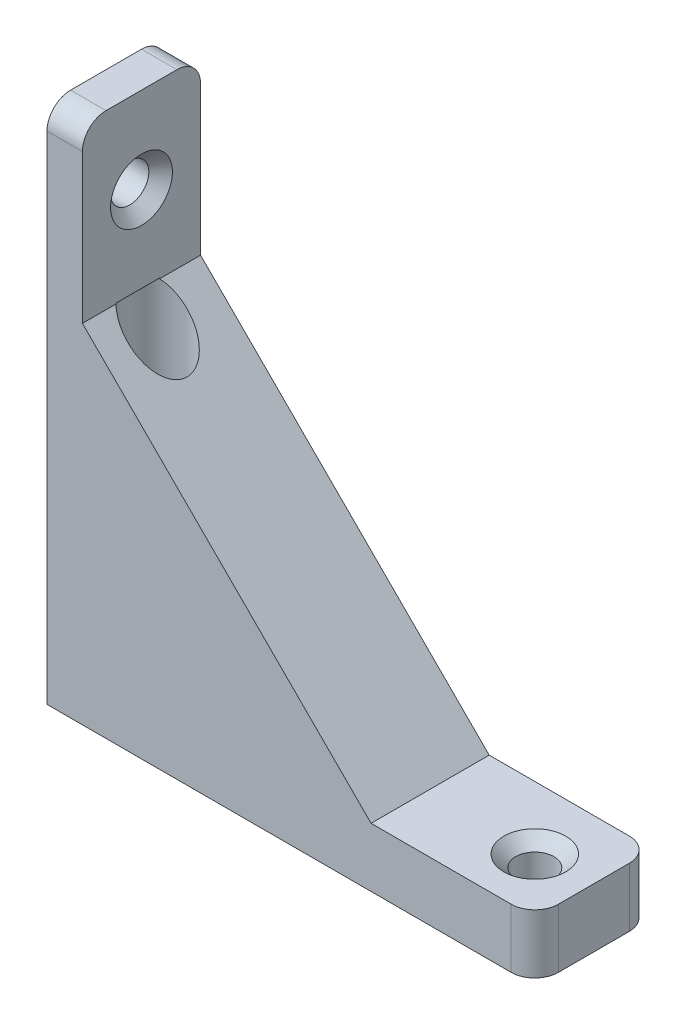
from build123d import *

# Parameters (mm, degrees)
ESTRUSIONE_ESTRUSIONE1_DEPTH = 10
SCHIZZO3_R                   = 1.62
TAGLIO_ESTRUSIONE1_DEPTH     = 8
SCHIZZO5_R                   = 1.62
TAGLIO_ESTRUSIONE4_DEPTH     = 24.5
SCHIZZO5_4_R                 = 2.5
TAGLIO_ESTRUSIONE5_DEPTH     = 24.5
SMUSSO4_SIZE                 = 1
SMUSSO5_SIZE                 = 1
SCHIZZO6_R                   = 1.62
TAGLIO_ESTRUSIONE6_DEPTH     = 24.5
SMUSSO6_SIZE                 = 1
RACCORDO1_R                  = 2


with BuildPart() as part:
    # Schizzo2 → Estrusione-Estrusione1 (new body)
    with BuildSketch(Plane.XY):
        Polygon((3, 29.438649361), (27.438649361, 5), (41.3, 5), (41.3, 0), (0, 0), (0, 5), (0, 44.039135738), (3, 44.039135738), align=None)
    extrude(amount=ESTRUSIONE_ESTRUSIONE1_DEPTH)

    # Schizzo3 → Taglio-Estrusione1 (cut)
    with BuildSketch(Plane(origin=(0, 5, 0), x_dir=(1, 0, 0), z_dir=(0, 1, 0))):
        with Locations(Location((36.62, -5.32, 0), (0, 0, 180))):
            Circle(SCHIZZO3_R)
    extrude(amount=-TAGLIO_ESTRUSIONE1_DEPTH, mode=Mode.SUBTRACT)

    # Schizzo5 → Taglio-Estrusione4 (cut)
    with BuildSketch(Plane(origin=(0, 5, 0), x_dir=(1, 0, 0), z_dir=(0, 1, 0))):
        with Locations(Location((4.68, -5.32, 0), (0, 0, 270))):
            Circle(SCHIZZO5_R)
    extrude(amount=-TAGLIO_ESTRUSIONE4_DEPTH, mode=Mode.SUBTRACT)

    # Schizzo5<4> → Taglio-Estrusione5 (cut)
    with BuildSketch(Plane(origin=(0, 5, 0), x_dir=(1, 0, 0), z_dir=(0, 1, 0))):
        with Locations(Location((4.68, -5.32, 0), (0, 0, 132.221614055))):
            Circle(SCHIZZO5_4_R)
    extrude(amount=TAGLIO_ESTRUSIONE5_DEPTH, mode=Mode.SUBTRACT)

    # Smusso4
    # the kernel refuses this chamfer: 1 mm, written as the material it takes off along each edge
    with BuildSketch(Plane(origin=(4.68, 5, 5.32), x_dir=(0, 0, 1), z_dir=(-1, 0, 0))) as smusso4_piece_1_section:
        Polygon((1.62 + SMUSSO4_SIZE, 0), (1.62, -SMUSSO4_SIZE), (1.62, 0), align=None)
    smusso4_piece_1 = revolve(axis=Axis((4.68, 5, 5.32), (0, 1, 0)), mode=Mode.PRIVATE)
    smusso4_piece_1 = smusso4_piece_1 & Plane(origin=(4.68, 4.439074745, 5.32), x_dir=(-0.6719999999981088, 0, -0.740551146108452), z_dir=(0, -1, 0)) * Cylinder(2.5, 11, mode=Mode.PRIVATE)
    add(smusso4_piece_1, mode=Mode.SUBTRACT)

    # Smusso5
    smusso5_edges = [part.edges().sort_by_distance(p)[0] for p in [
        (38.24, 5, 5.32),
    ]]
    chamfer(smusso5_edges, length=SMUSSO5_SIZE)

    # Schizzo6 → Taglio-Estrusione6 (cut)
    with BuildSketch(Plane(origin=(3, 0, 0), x_dir=(0, 0, -1), z_dir=(1, 0, 0))):
        with Locations((-5, 36.73889255)):
            Circle(SCHIZZO6_R)
    extrude(amount=-TAGLIO_ESTRUSIONE6_DEPTH, mode=Mode.SUBTRACT)

    # Smusso6
    smusso6_edges = [part.edges().sort_by_distance(p)[0] for p in [
        (3, 36.73889255, 6.62),
    ]]
    chamfer(smusso6_edges, length=SMUSSO6_SIZE)

    # Raccordo1
    raccordo1_edges = [part.edges().sort_by_distance(p)[0] for p in [
        (1.5, 44.039135738, 0),
        (41.3, 2.5, 10),
        (1.5, 44.039135738, 10),
        (41.3, 2.5, 0),
    ]]
    fillet(raccordo1_edges, radius=RACCORDO1_R)


solid = part.part
